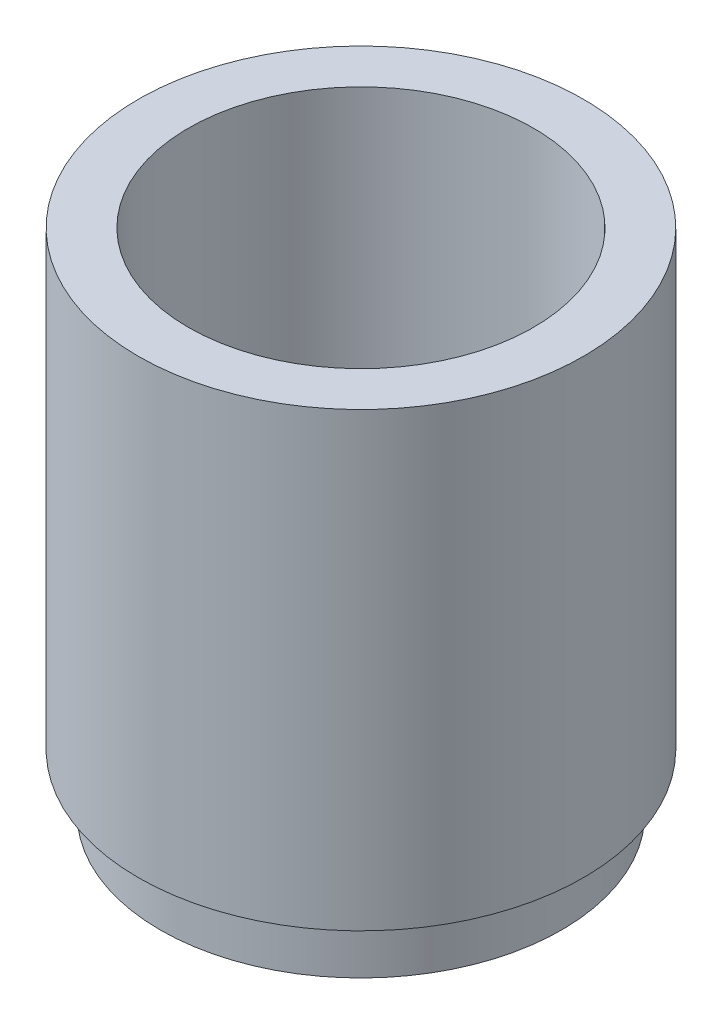
from build123d import *

# Parameters (mm, degrees)
SKETCH1_R           = 8.025
SKETCH1_R_2         = 6.4
BOSS_EXTRUDE1_DEPTH = 2.25
SKETCH2_R           = 8.9
SKETCH2_R_2         = 6.9
BOSS_EXTRUDE2_DEPTH = 18.05


with BuildPart() as part:
    # Sketch1 → Boss-Extrude1 (new body)
    with BuildSketch(Plane(origin=(0, 0, 0), x_dir=(1, 0, 0), z_dir=(0, 1, 0))):
        Circle(SKETCH1_R)
        Circle(SKETCH1_R_2, mode=Mode.SUBTRACT)
    extrude(amount=BOSS_EXTRUDE1_DEPTH)

    # Sketch2 → Boss-Extrude2 (add)
    with BuildSketch(Plane(origin=(0, 2.25, 0), x_dir=(1, 0, 0), z_dir=(0, 1, 0))):
        Circle(SKETCH2_R)
        Circle(SKETCH2_R_2, mode=Mode.SUBTRACT)
    extrude(amount=BOSS_EXTRUDE2_DEPTH)


solid = part.part
